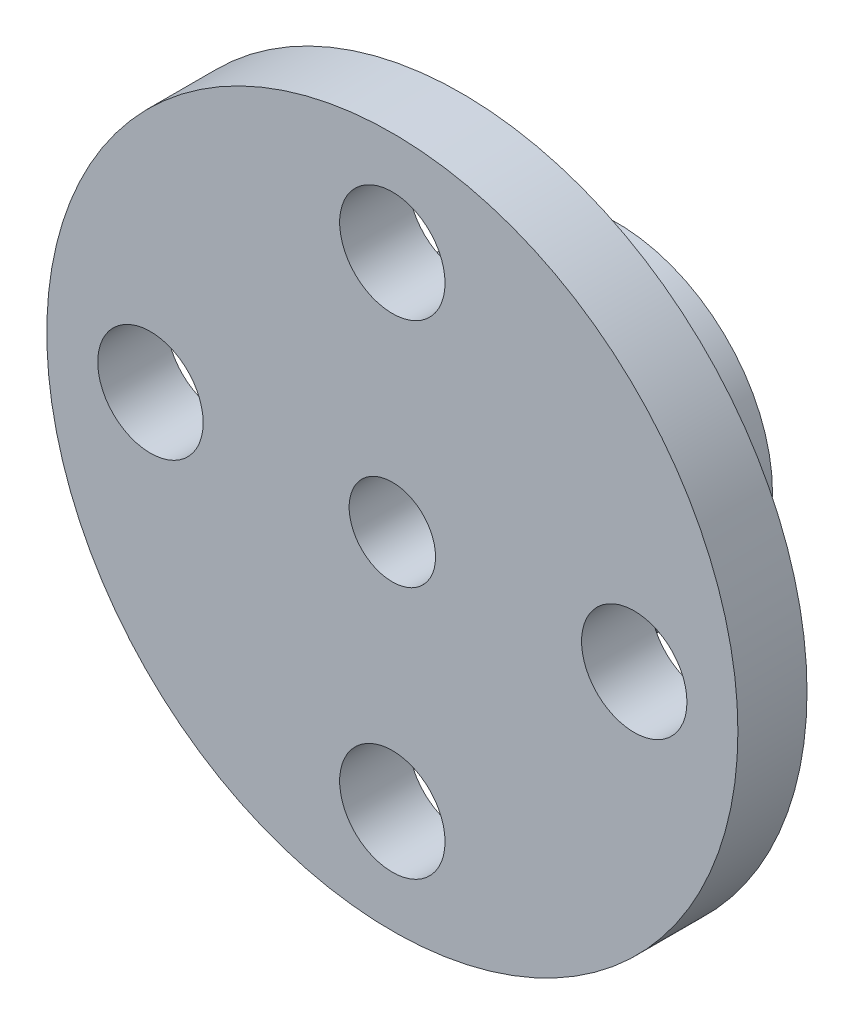
from build123d import *

# Parameters (mm, degrees)
SKETCH1_R           = 4.5
BOSS_EXTRUDE1_DEPTH = 6.5
SKETCH2_R           = 10
SKETCH2_R_2         = 1.25
BOSS_EXTRUDE2_DEPTH = 2
SKETCH3_R           = 1.525
CUT_EXTRUDE1_DEPTH  = 16.564382416


with BuildPart() as part:
    # Sketch1 → Boss-Extrude1 (new body)
    with BuildSketch(Plane.XY.offset(7)):
        Circle(SKETCH1_R)
        with BuildLine():
            Line((-1.743463309, 2.563266606), (-1.337804671, 2.314678673))
            ThreePointArc((-1.337804671, 2.314678673), (-1.287955514, 2.342782383), (-1.237516253, 2.369812698))
            Line((-1.237516253, 2.369812698), (-1.230043219, 2.845521688))
            ThreePointArc((-1.230043219, 2.845521688), (-1.141186113, 2.882307106), (-1.05123072, 2.916318565))
            Line((-1.05123072, 2.916318565), (-0.7201379, 2.574657279))
            ThreePointArc((-0.7201379, 2.574657279), (-0.664865737, 2.589481077), (-0.609288952, 2.603118451))
            Line((-0.609288952, 2.603118451), (-0.483746682, 3.062023701))
            ThreePointArc((-0.483746682, 3.062023701), (-0.388533024, 3.075555574), (-0.292945439, 3.086127504))
            Line((-0.292945439, 3.086127504), (-0.057222215, 2.672860699))
            ThreePointArc((-0.057222215, 2.672860699), (0, 2.673473153), (0.057222215, 2.672860699))
            Line((0.057222215, 2.672860699), (0.292945439, 3.086127504))
            ThreePointArc((0.292945439, 3.086127504), (0.388533024, 3.075555574), (0.483746682, 3.062023701))
            Line((0.483746682, 3.062023701), (0.609288952, 2.603118451))
            ThreePointArc((0.609288952, 2.603118451), (0.664865737, 2.589481077), (0.7201379, 2.574657279))
            Line((0.7201379, 2.574657279), (1.05123072, 2.916318565))
            ThreePointArc((1.05123072, 2.916318565), (1.141186113, 2.882307106), (1.230043219, 2.845521688))
            Line((1.230043219, 2.845521688), (1.237516253, 2.369812698))
            ThreePointArc((1.237516253, 2.369812698), (1.287955514, 2.342782383), (1.337804671, 2.314678673))
            Line((1.337804671, 2.314678673), (1.743463309, 2.563266606))
            ThreePointArc((1.743463309, 2.563266606), (1.822134282, 2.507952683), (1.899051617, 2.450225083))
            Line((1.899051617, 2.450225083), (1.787985857, 1.987602897))
            ThreePointArc((1.787985857, 1.987602897), (1.830118309, 1.948878055), (1.871412256, 1.909260293))
            Line((1.871412256, 1.909260293), (2.326147686, 2.049155178))
            ThreePointArc((2.326147686, 2.049155178), (2.388591053, 1.976014368), (2.448735618, 1.900971824))
            Line((2.448735618, 1.900971824), (2.226109733, 1.480504696))
            ThreePointArc((2.226109733, 1.480504696), (2.257288041, 1.432518551), (2.287432125, 1.383876068))
            Line((2.287432125, 1.383876068), (2.762671649, 1.406287795))
            ThreePointArc((2.762671649, 1.406287795), (2.804963863, 1.319915804), (2.844556554, 1.232273514))
            Line((2.844556554, 1.232273514), (2.524358948, 0.88038094))
            ThreePointArc((2.524358948, 0.88038094), (2.542624063, 0.826148638), (2.559724222, 0.771537819))
            Line((2.559724222, 0.771537819), (3.025606792, 0.675058177))
            ThreePointArc((3.025606792, 0.675058177), (3.045090477, 0.580882075), (3.06164354, 0.486146927))
            Line((3.06164354, 0.486146927), (2.663993406, 0.224939612))
            ThreePointArc((2.663993406, 0.224939612), (2.668197664, 0.167868768), (2.671179432, 0.110721012))
            Line((2.671179432, 0.110721012), (3.098431932, -0.098587829))
            ThreePointArc((3.098431932, -0.098587829), (3.093882858, -0.194650611), (3.086356203, -0.290526059))
            Line((3.086356203, -0.290526059), (2.636239362, -0.444635499))
            ThreePointArc((2.636239362, -0.444635499), (2.626118593, -0.500958914), (2.614794614, -0.557052804))
            Line((2.614794614, -0.557052804), (2.9765712, -0.866039198))
            ThreePointArc((2.9765712, -0.866039198), (2.948275201, -0.957952683), (2.917141754, -1.048944224))
            Line((2.917141754, -1.048944224), (2.442840702, -1.086272527))
            ThreePointArc((2.442840702, -1.086272527), (2.419030833, -1.138309505), (2.394112634, -1.189824943))
            Line((2.394112634, -1.189824943), (2.667681551, -1.57907414))
            ThreePointArc((2.667681551, -1.57907414), (2.617416569, -1.661063064), (2.564632561, -1.741453366))
            Line((2.564632561, -1.741453366), (2.095949377, -1.659655056))
            ThreePointArc((2.095949377, -1.659655056), (2.059946468, -1.704135923), (2.022999752, -1.747836005))
            Line((2.022999752, -1.747836005), (2.19117166, -2.192890046))
            ThreePointArc((2.19117166, -2.192890046), (2.122096028, -2.259802745), (2.050978072, -2.324540589))
            Line((2.050978072, -2.324540589), (1.617361845, -2.128755355))
            ThreePointArc((1.617361845, -2.128755355), (1.571428092, -2.162885215), (1.524774356, -2.196024103))
            Line((1.524774356, -2.196024103), (1.576982395, -2.668918606))
            ThreePointArc((1.576982395, -2.668918606), (1.49343639, -2.716550708), (1.408453087, -2.761568377))
            Line((1.408453087, -2.761568377), (1.037149519, -2.464098126))
            ThreePointArc((1.037149519, -2.464098126), (0.984171108, -2.485732473), (0.930741779, -2.50622793))
            Line((0.930741779, -2.50622793), (0.863705526, -2.977249194))
            ThreePointArc((0.863705526, -2.977249194), (0.77093865, -3.002607799), (0.677429816, -3.025076668))
            Line((0.677429816, -3.025076668), (0.391769275, -2.644612549))
            ThreePointArc((0.391769275, -2.644612549), (0.335075035, -2.652392018), (0.278227274, -2.658956239))
            Line((0.278227274, -2.658956239), (0.096158863, -3.098508266))
            ThreePointArc((0.096158863, -3.098508266), (0, -3.1), (-0.096158863, -3.098508266))
            Line((-0.096158863, -3.098508266), (-0.278227274, -2.658956239))
            ThreePointArc((-0.278227274, -2.658956239), (-0.335075035, -2.652392018), (-0.391769275, -2.644612549))
            Line((-0.391769275, -2.644612549), (-0.677429816, -3.025076668))
            ThreePointArc((-0.677429816, -3.025076668), (-0.77093865, -3.002607799), (-0.863705526, -2.977249194))
            Line((-0.863705526, -2.977249194), (-0.930741779, -2.50622793))
            ThreePointArc((-0.930741779, -2.50622793), (-0.984171108, -2.485732473), (-1.037149519, -2.464098126))
            Line((-1.037149519, -2.464098126), (-1.408453087, -2.761568377))
            ThreePointArc((-1.408453087, -2.761568377), (-1.49343639, -2.716550708), (-1.576982395, -2.668918606))
            Line((-1.576982395, -2.668918606), (-1.524774356, -2.196024103))
            ThreePointArc((-1.524774356, -2.196024103), (-1.571428092, -2.162885215), (-1.617361845, -2.128755355))
            Line((-1.617361845, -2.128755355), (-2.050978072, -2.324540589))
            ThreePointArc((-2.050978072, -2.324540589), (-2.122096028, -2.259802745), (-2.19117166, -2.192890046))
            Line((-2.19117166, -2.192890046), (-2.022999752, -1.747836005))
            ThreePointArc((-2.022999752, -1.747836005), (-2.059946468, -1.704135923), (-2.095949377, -1.659655056))
            Line((-2.095949377, -1.659655056), (-2.564632561, -1.741453366))
            ThreePointArc((-2.564632561, -1.741453366), (-2.617416569, -1.661063064), (-2.667681551, -1.57907414))
            Line((-2.667681551, -1.57907414), (-2.394112634, -1.189824943))
            ThreePointArc((-2.394112634, -1.189824943), (-2.419030833, -1.138309505), (-2.442840702, -1.086272527))
            Line((-2.442840702, -1.086272527), (-2.917141754, -1.048944224))
            ThreePointArc((-2.917141754, -1.048944224), (-2.948275201, -0.957952683), (-2.9765712, -0.866039198))
            Line((-2.9765712, -0.866039198), (-2.614794614, -0.557052804))
            ThreePointArc((-2.614794614, -0.557052804), (-2.626118593, -0.500958914), (-2.636239362, -0.444635499))
            Line((-2.636239362, -0.444635499), (-3.086356203, -0.290526059))
            ThreePointArc((-3.086356203, -0.290526059), (-3.093882858, -0.194650611), (-3.098431932, -0.098587829))
            Line((-3.098431932, -0.098587829), (-2.671179432, 0.110721012))
            ThreePointArc((-2.671179432, 0.110721012), (-2.668197664, 0.167868768), (-2.663993406, 0.224939612))
            Line((-2.663993406, 0.224939612), (-3.06164354, 0.486146927))
            ThreePointArc((-3.06164354, 0.486146927), (-3.045090477, 0.580882075), (-3.025606792, 0.675058177))
            Line((-3.025606792, 0.675058177), (-2.559724222, 0.771537819))
            ThreePointArc((-2.559724222, 0.771537819), (-2.542624063, 0.826148638), (-2.524358948, 0.88038094))
            Line((-2.524358948, 0.88038094), (-2.844556554, 1.232273514))
            ThreePointArc((-2.844556554, 1.232273514), (-2.804963863, 1.319915804), (-2.762671649, 1.406287795))
            Line((-2.762671649, 1.406287795), (-2.287432125, 1.383876068))
            ThreePointArc((-2.287432125, 1.383876068), (-2.257288041, 1.432518551), (-2.226109733, 1.480504696))
            Line((-2.226109733, 1.480504696), (-2.448735618, 1.900971824))
            ThreePointArc((-2.448735618, 1.900971824), (-2.388591053, 1.976014368), (-2.326147686, 2.049155178))
            Line((-2.326147686, 2.049155178), (-1.871412256, 1.909260293))
            ThreePointArc((-1.871412256, 1.909260293), (-1.830118309, 1.948878055), (-1.787985857, 1.987602897))
            Line((-1.787985857, 1.987602897), (-1.899051617, 2.450225083))
            ThreePointArc((-1.899051617, 2.450225083), (-1.822134282, 2.507952683), (-1.743463309, 2.563266606))
        make_face(mode=Mode.SUBTRACT)
    extrude(amount=-BOSS_EXTRUDE1_DEPTH)

    # Sketch2 → Boss-Extrude2 (add)
    with BuildSketch(Plane.XY.offset(7)):
        Circle(SKETCH2_R)
        Circle(SKETCH2_R_2, mode=Mode.SUBTRACT)
    extrude(amount=-BOSS_EXTRUDE2_DEPTH)

    # Sketch3 → Cut-Extrude1 (cut, through all)
    with BuildSketch(Plane.XY.offset(7)):
        with Locations((0, 7)):
            Circle(SKETCH3_R)
        with Locations((7, 0)):
            Circle(SKETCH3_R)
        with Locations((0, -7)):
            Circle(SKETCH3_R)
        with Locations((-7, 0)):
            Circle(SKETCH3_R)
    extrude(amount=-CUT_EXTRUDE1_DEPTH, mode=Mode.SUBTRACT)


solid = part.part
